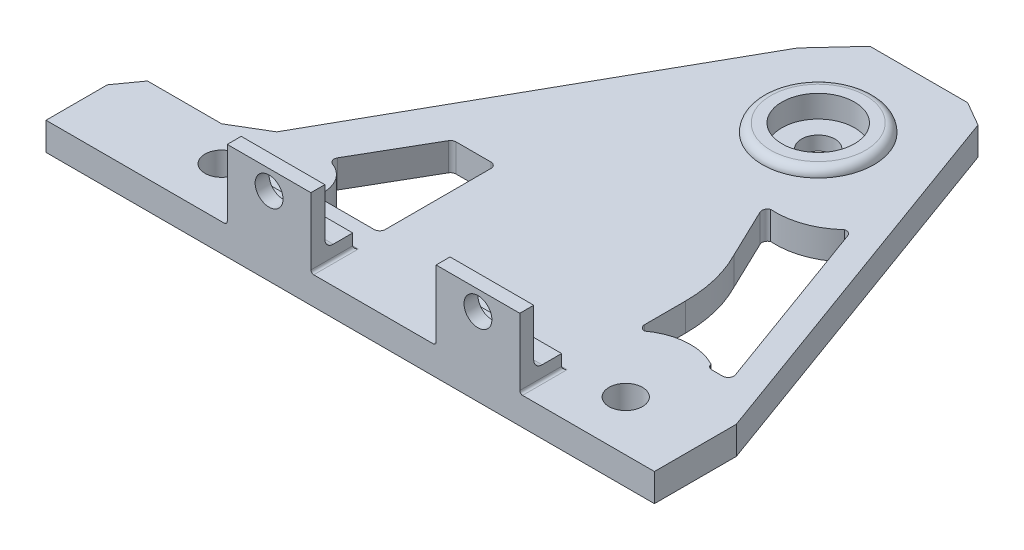
from build123d import *

# Parameters (mm, degrees)
CROQUIS1_R              = 13
CROQUIS1_R_2            = 6
SALIENTE_EXTRUIR1_DEPTH = 10
CROQUIS2_W              = 30
CROQUIS2_H              = 15
SALIENTE_EXTRUIR2_DEPTH = 5
CROQUIS3_W              = 30
CROQUIS3_H              = 5
SALIENTE_EXTRUIR3_DEPTH = 20
CROQUIS4_R              = 5
CORTAR_EXTRUIR1_DEPTH   = 20
REDONDEO1_R             = 1
REDONDEO2_R             = 1
REDONDEO3_R             = 3
CROQUIS5_R              = 13
CROQUIS5_R_2            = 6
SALIENTE_EXTRUIR4_DEPTH = 5
CROQUIS6_R              = 20
CROQUIS6_R_2            = 13
SALIENTE_EXTRUIR5_DEPTH = 3
REDONDEO4_R             = 3


with BuildPart() as part:
    # Croquis1 → Saliente-Extruir1 (new body)
    with BuildSketch(Plane(origin=(0, 0, 0), x_dir=(1, 0, 0), z_dir=(0, 1, 0))):
        Polygon((-109.095, 0), (109.095, 0), (109.095, 29.37), (59.500415879, 165.63), (50.697846821, 170.712165615), (15.697846821, 170.712165615), (3.225, 157.21), (-64.095, 37.77), (-76.489816261, 30.39), (-103.085, 30.39), (-109.095, 22), align=None)
        with Locations(Location((33.197846821, 134.63, 0), (0, 0, 270))):
            Circle(CROQUIS1_R, mode=Mode.SUBTRACT)
        with Locations(Location((-64.095, 18, 0), (0, 0, 270))):
            Circle(CROQUIS1_R_2, mode=Mode.SUBTRACT)
        with Locations(Location((80.805, 18, 0), (0, 0, 270))):
            Circle(CROQUIS1_R_2, mode=Mode.SUBTRACT)
        with BuildLine():
            Line((-34.959241143, 24.905539046), (-16.329241143, 24.905539046))
            ThreePointArc((-16.329241143, 24.905539046), (-14.915027581, 25.491325484), (-14.329241143, 26.905539046))
            Line((-14.329241143, 26.905539046), (-14.329241143, 64.805539046))
            ThreePointArc((-14.329241143, 64.805539046), (-14.915027581, 66.219752609), (-16.329241143, 66.805539046))
            Line((-16.329241143, 66.805539046), (-28.864540605, 66.805539046))
            ThreePointArc((-28.864540605, 66.805539046), (-29.864540605, 66.537589854), (-30.596591412, 65.805539046))
            Line((-30.596591412, 65.805539046), (-45.124461509, 40.642529914))
            ThreePointArc((-45.124461509, 40.642529914), (-45.275154746, 38.967789325), (-44.095, 37.77))
            ThreePointArc((-44.095, 37.77), (-38.917486541, 33.735802046), (-36.959241143, 27.471085475))
            Line((-36.959241143, 27.471085475), (-36.959241143, 26.905539046))
            ThreePointArc((-36.959241143, 26.905539046), (-36.373454706, 25.491325484), (-34.959241143, 24.905539046))
        make_face(mode=Mode.SUBTRACT)
        with BuildLine():
            Line((70.518843068, 107.928122629), (93.592402069, 44.534040287))
            ThreePointArc((93.592402069, 44.534040287), (93.351320916, 42.702847127), (91.713016828, 41.85))
            Line((91.713016828, 41.85), (87.853935228, 41.85))
            ThreePointArc((87.853935228, 41.85), (86.557059698, 42.32746466), (85.879396403, 43.53188614))
            ThreePointArc((85.879396403, 43.53188614), (74.558636842, 45.862576394), (63.719312841, 41.85))
            ThreePointArc((63.719312841, 41.85), (62.305099279, 42.435786438), (61.719312841, 43.85))
            Line((61.719312841, 43.85), (61.719312841, 58.5))
            ThreePointArc((61.719312841, 58.5), (60.302618614, 70.31788476), (56.132816833, 81.466076355))
            Line((56.132816833, 81.466076355), (47.469675424, 99.515111912))
            ThreePointArc((47.469675424, 99.515111912), (47.413687511, 101.118061517), (48.553338923, 102.246678699))
            ThreePointArc((48.553338923, 102.246678699), (59.00154122, 103.684084154), (68.023190025, 109.146768338))
            ThreePointArc((68.023190025, 109.146768338), (69.517034466, 109.041263258), (70.518843068, 107.928122629))
        make_face(mode=Mode.SUBTRACT)
    extrude(amount=SALIENTE_EXTRUIR1_DEPTH)

    # Croquis2 → Saliente-Extruir2 (add)
    with BuildSketch(Plane(origin=(0, 10, 0), x_dir=(1, 0, 0), z_dir=(0, 1, 0))):
        with Locations((-29.095, 7.5)):
            Rectangle(CROQUIS2_W, CROQUIS2_H)
        with Locations((45.805, 7.5)):
            Rectangle(CROQUIS2_W, CROQUIS2_H)
    extrude(amount=SALIENTE_EXTRUIR2_DEPTH)

    # Croquis3 → Saliente-Extruir3 (add)
    with BuildSketch(Plane(origin=(0, 15, 0), x_dir=(1, 0, 0), z_dir=(0, 1, 0))):
        with Locations((-29.095, 2.5)):
            Rectangle(CROQUIS3_W, CROQUIS3_H)
        with Locations((45.805, 2.5)):
            Rectangle(CROQUIS3_W, CROQUIS3_H)
    extrude(amount=SALIENTE_EXTRUIR3_DEPTH)

    # Croquis4 → Cortar-Extruir1 (cut)
    with BuildSketch(Plane(origin=(0, 0, -5), x_dir=(-1, 0, 0), z_dir=(0, 0, -1))):
        with Locations((-45.805, 28)):
            Circle(CROQUIS4_R)
        with Locations((29.095, 28)):
            Circle(CROQUIS4_R)
    extrude(amount=-CORTAR_EXTRUIR1_DEPTH, mode=Mode.SUBTRACT)

    # Redondeo1
    redondeo1_edges = [part.edges().sort_by_distance(p)[0] for p in [
        (-14.095, 10, -7.5),
        (-44.095, 10, -7.5),
        (60.805, 10, -7.5),
        (30.805, 10, -7.5),
    ]]
    fillet(redondeo1_edges, radius=REDONDEO1_R)

    # Redondeo2
    redondeo2_edges = [part.edges().sort_by_distance(p)[0] for p in [
        (45.805, 10, -15),
        (-29.095, 10, -15),
    ]]
    fillet(redondeo2_edges, radius=REDONDEO2_R)

    # Redondeo3
    redondeo3_edges = [part.edges().sort_by_distance(p)[0] for p in [
        (-29.095, 15, -5),
        (45.805, 15, -5),
    ]]
    fillet(redondeo3_edges, radius=REDONDEO3_R)

    # Croquis5 → Saliente-Extruir4 (add)
    with BuildSketch(Plane.XZ):
        with Locations(Location((33.197846821, -134.63, 0), (0, 0, 270))):
            Circle(CROQUIS5_R)
        with Locations(Location((33.197846821, -134.63, 0), (0, 0, 270))):
            Circle(CROQUIS5_R_2, mode=Mode.SUBTRACT)
    extrude(amount=-SALIENTE_EXTRUIR4_DEPTH)

    # Croquis6 → Saliente-Extruir5 (add)
    with BuildSketch(Plane(origin=(0, 10, 0), x_dir=(1, 0, 0), z_dir=(0, 1, 0))):
        with Locations(Location((33.197846821, 134.63, 0), (0, 0, 270))):
            Circle(CROQUIS6_R)
        with Locations(Location((33.197846821, 134.63, 0), (0, 0, 90))):
            Circle(CROQUIS6_R_2, mode=Mode.SUBTRACT)
    extrude(amount=SALIENTE_EXTRUIR5_DEPTH)

    # Redondeo4
    redondeo4_edges = [part.edges().sort_by_distance(p)[0] for p in [
        (33.197846821, 13, -154.63),
    ]]
    fillet(redondeo4_edges, radius=REDONDEO4_R - 0.0001)  # a hair under: the kernel refuses the full size


solid = part.part
